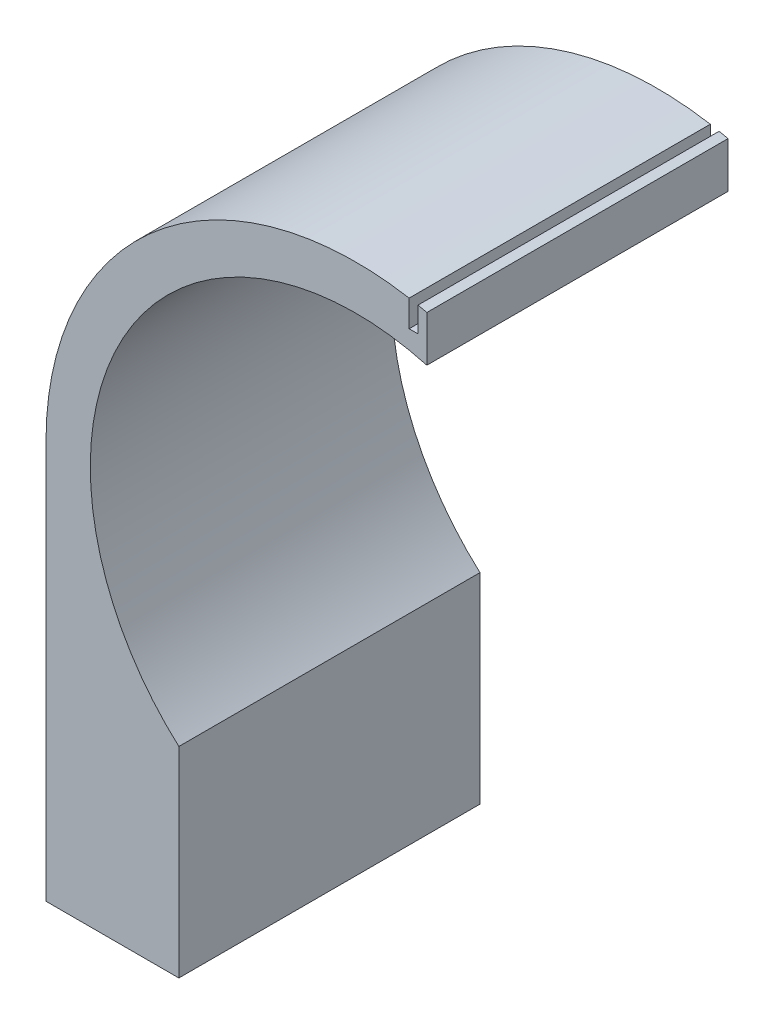
from build123d import *

# Parameters (mm, degrees)
INNER_RING_LEFT_SIDE_DEPTH = 170


with BuildPart() as part:
    # Sketch1 → Inner Ring - Left Side (new body)
    with BuildSketch(Plane.XY):
        with BuildLine():
            Line((-100, -111.803398875), (-100, -225))
            Line((-100, -225), (-175, -225))
            Line((-175, -225), (-175, 0))
            ThreePointArc((-175, 0), (-112.638803261, 133.93095236), (30, 172.409396496))
            Line((30, 172.409396496), (30, 157.409396496))
            Line((30, 157.409396496), (35, 157.409396496))
            Line((35, 157.409396496), (35, 171.464281995))
            ThreePointArc((35, 171.464281995), (37.50401138, 170.934049067), (40, 170.367250374))
            Line((40, 170.367250374), (40, 144.568322948))
            ThreePointArc((40, 144.568322948), (-131.649591483, 71.891481153), (-100, -111.803398875))
        make_face()
    extrude(amount=INNER_RING_LEFT_SIDE_DEPTH)


solid = part.part
